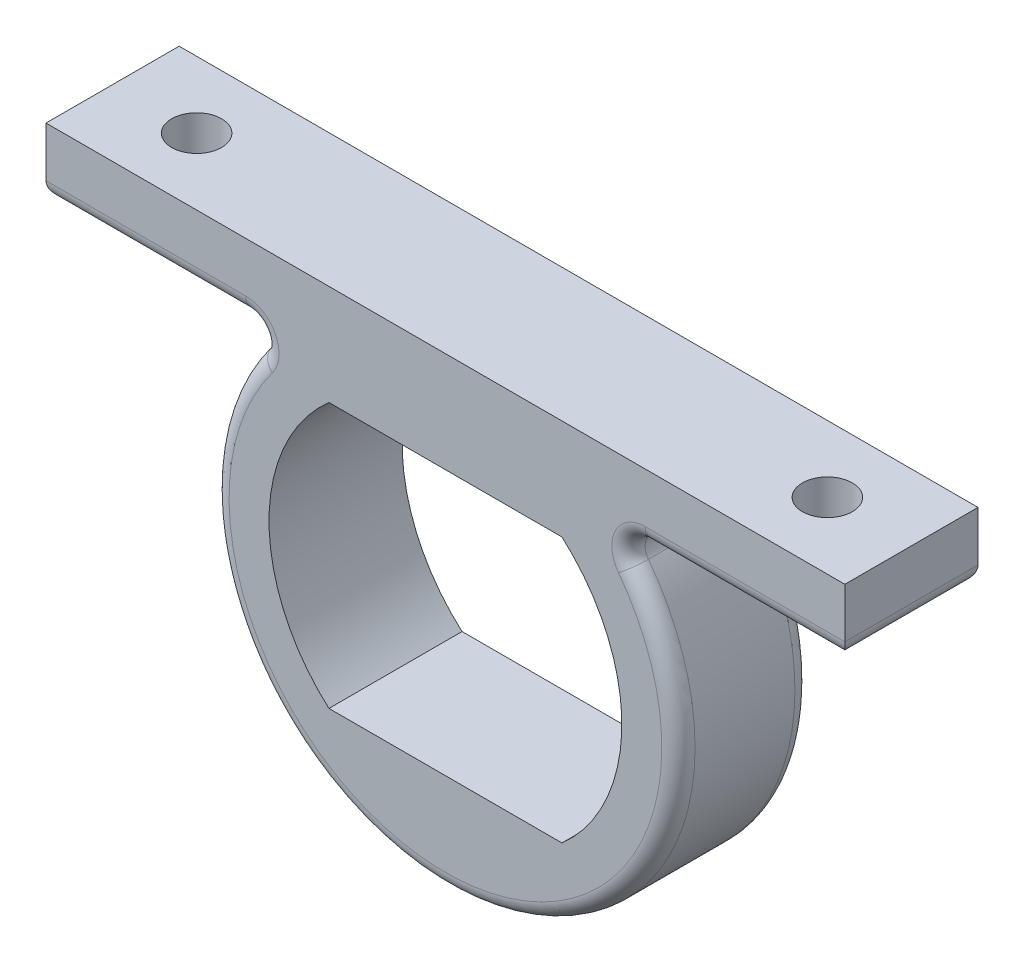
from build123d import *

# Parameters (mm, degrees)
SALIENTE_EXTRUIR1_DEPTH = 8
CORTAR_EXTRUIR1_DEPTH   = 29.91366459
REDONDEO1_R             = 1
CROQUIS3_R              = 1.5
CORTAR_EXTRUIR2_DEPTH   = 35.871191548


with BuildPart() as part:
    # Croquis1 → Saliente-Extruir1 (new body)
    with BuildSketch(Plane.XY):
        with BuildLine():
            Line((0, 14), (-24, 14))
            Line((-24, 14), (-24, 10))
            Line((-24, 10), (-9.797958971, 10))
            ThreePointArc((-9.797958971, 10), (0, -14), (9.797958971, 10))
            Line((9.797958971, 10), (24, 10))
            Line((24, 10), (24, 14))
            Line((24, 14), (0, 14))
        make_face()
    extrude(amount=SALIENTE_EXTRUIR1_DEPTH)

    # Croquis2 → Cortar-Extruir1 (cut, through all)
    with BuildSketch(Plane.XY.offset(8)):
        with BuildLine():
            Line((-7, 7.959899497), (7, 7.959899497))
            ThreePointArc((7, 7.959899497), (10.6, 0), (7, -7.959899497))
            Line((7, -7.959899497), (-7, -7.959899497))
            ThreePointArc((-7, -7.959899497), (-10.6, 0), (-7, 7.959899497))
        make_face()
    extrude(amount=-CORTAR_EXTRUIR1_DEPTH, mode=Mode.SUBTRACT)

    # Redondeo1
    redondeo1_edges = [part.edges().sort_by_distance(p)[0] for p in [
        (-16.898979486, 10, 8),
        (-16.898979486, 10, 0),
        (16.898979486, 10, 8),
        (16.898979486, 10, 0),
        (-9.797958971, 10, 4),
        (0, -14, 8),
        (9.797958971, 10, 4),
        (0, -14, 0),
        (24, 10, 4),
        (-24, 10, 4),
    ]]
    fillet(redondeo1_edges, radius=REDONDEO1_R)

    # Croquis3 → Cortar-Extruir2 (cut, through all)
    with BuildSketch(Plane(origin=(0, 10, 0), x_dir=(-1, 0, 0), z_dir=(0, -1, 0))):
        with Locations((18.949489743, -4)):
            Circle(CROQUIS3_R)
        with Locations((-18.949489743, -4)):
            Circle(CROQUIS3_R)
    extrude(amount=-CORTAR_EXTRUIR2_DEPTH, mode=Mode.SUBTRACT)


solid = part.part
